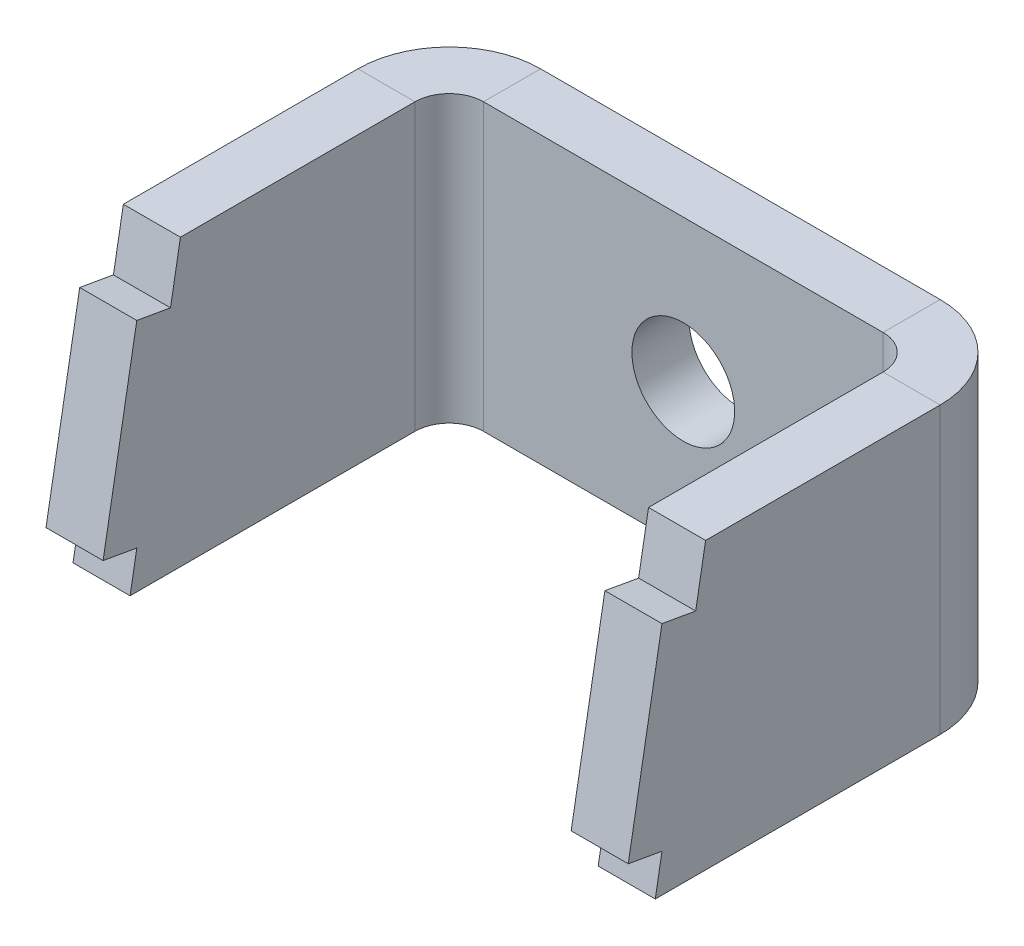
from build123d import *

# Parameters (mm, degrees)
SKETCH_1_W             = 35
SKETCH_1_H             = 25
SM_BASE_FLANGE_1_DEPTH = 5
SM_EDGE_FLANGE_1_DEPTH = 25
SM_EDGE_FLANGE_2_DEPTH = 25
CUT_EXTRUDE_1_DEPTH    = 65.707032075
CUT_EXTRUDE_3_DEPTH    = 65.707032075
SKETCH_35_R            = 4.5
CUT_EXTRUDE_2_DEPTH    = 51.227169575


# Sheet-metal steps are written as plain solids
with BuildPart() as part:
    # Sketch 1 → Базовая кромка1 (new body)
    with BuildSketch(Plane.XY):
        with Locations((0, 12.5)):
            Rectangle(SKETCH_1_W, SKETCH_1_H)
    extrude(amount=-SM_BASE_FLANGE_1_DEPTH)

    # Ребро-кромка1 section (across the edge) → Ребро-кромка1 (add)
    with BuildSketch(Plane(origin=(-20.5, 25, 0), x_dir=(1, 0, 0), z_dir=(0, -1, 0))):
        with BuildLine():
            Line((-5, 3), (-5, 31))
            Line((-5, 31), (0, 31))
            Line((0, 31), (0, 3))
            ThreePointArc((0, 3), (0.878679656, 0.878679656), (3, 0))
            Line((3, 0), (3, -5))
            ThreePointArc((3, -5), (-2.656854249, -2.656854249), (-5, 3))
        make_face()
    extrude(amount=SM_EDGE_FLANGE_1_DEPTH)

    # Ребро-кромка2 section (across the edge) → Ребро-кромка2 (add)
    with BuildSketch(Plane(origin=(20.5, 0, 0), x_dir=(-1, 0, 0), z_dir=(0, 1, 0))):
        with BuildLine():
            Line((-5, 3), (-5, 31))
            Line((-5, 31), (0, 31))
            Line((0, 31), (0, 3))
            ThreePointArc((0, 3), (0.878679656, 0.878679656), (3, 0))
            Line((3, 0), (3, -5))
            ThreePointArc((3, -5), (-2.656854249, -2.656854249), (-5, 3))
        make_face()
    extrude(amount=SM_EDGE_FLANGE_2_DEPTH)

    # Эскиз33 → Вырез-Вытянуть1 (cut, through all)
    with BuildSketch(Plane(origin=(25.5, 0, 0), x_dir=(0, 0, -1), z_dir=(1, 0, 0))):
        Polygon((-31, 0), (-31, 25), (-26.591825482, 25), align=None)
    extrude(amount=-CUT_EXTRUDE_1_DEPTH, mode=Mode.SUBTRACT)

    # Эскиз36 → Вырез-Вытянуть3 (cut, through all)
    with BuildSketch(Plane(origin=(25.5, 0, 0), x_dir=(0, 0, -1), z_dir=(1, 0, 0))):
        Polygon((-26.591825482, 25), (-27.368209794, 20.596905768), (-24.413786535, 20.075961235), (-23.545545647, 25), align=None)
        Polygon((-27.365805555, 3.334229434), (-30.320228814, 3.855173967), (-31, 0), (-27.953720164, 0), align=None)
    extrude(amount=-CUT_EXTRUDE_3_DEPTH, mode=Mode.SUBTRACT)

    # Эскиз35 → Вырез-Вытянуть2 (cut, through all)
    with BuildSketch(Plane(origin=(0, 0, -5), x_dir=(-1, 0, 0), z_dir=(0, 0, -1))):
        with Locations((0, 12.5)):
            Circle(SKETCH_35_R)
    extrude(amount=-CUT_EXTRUDE_2_DEPTH, mode=Mode.SUBTRACT)


solid = part.part
